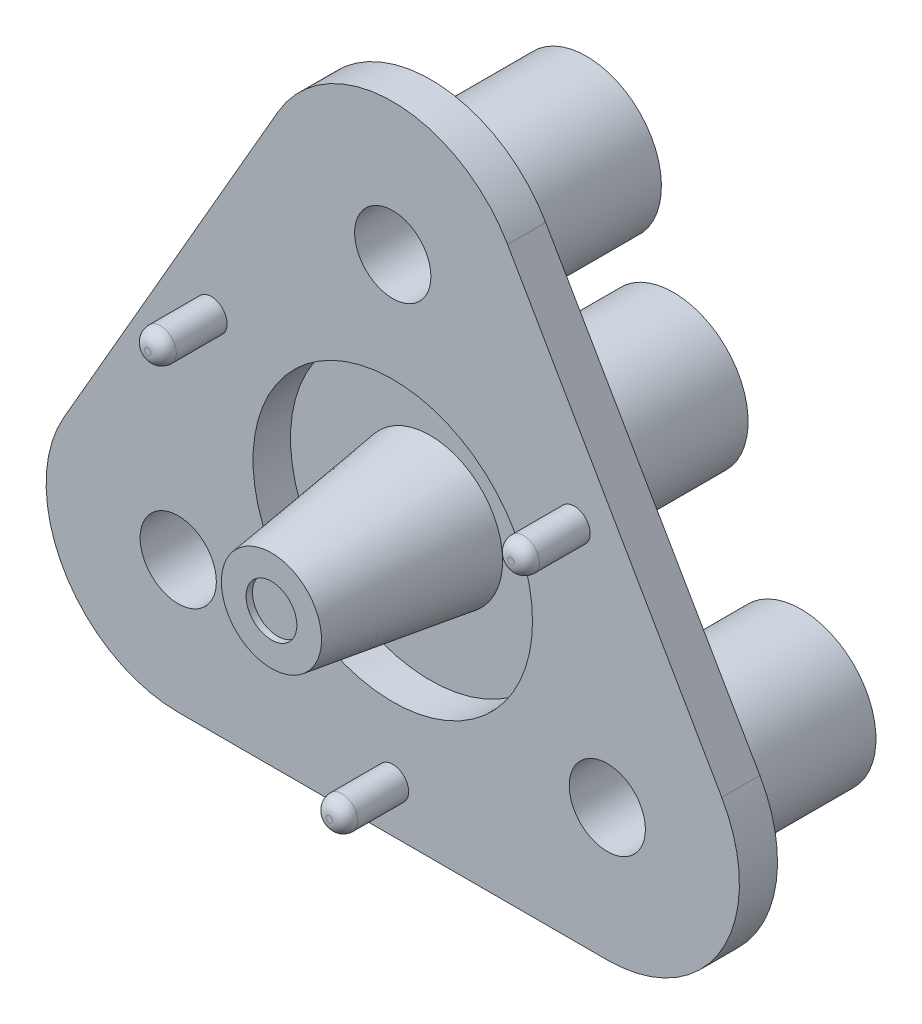
from build123d import *

# Parameters (mm, degrees)
BOSS_EXTRUDE1_DEPTH      = 1.524
SKETCH2_R                = 5.588
CUT_EXTRUDE1_DEPTH       = 1.4986
SKETCH3_R                = 2.8956
BOSS_EXTRUDE2_DEPTH      = 6.35
CHAMFER1_SIZE            = 6.35
CHAMFER1_SIZE_2          = 0.8924343
SKETCH4_R                = 1.016
CUT_EXTRUDE2_DEPTH       = 0.254
SKETCH5_R                = 7.366
BOSS_EXTRUDE3_DEPTH      = 1.778
BOSS_EXTRUDE4_DEPTH      = 1.778
CIRPATTERN1_COUNT        = 3
SKETCH7_R                = 2.9972
BOSS_EXTRUDE5_DEPTH      = 4.445
CIRPATTERN2_COUNT        = 3
SKETCH8_R                = 1.4859
CUT_EXTRUDE3_DEPTH       = 0.0508
CIRPATTERN3_COUNT        = 3
SKETCH9_R                = 2.9845
BOSS_EXTRUDE6_DEPTH      = 7.9248
CUT_EXTRUDE4_DEPTH       = 14.732
SKETCH11_R               = 1.524
CUT_EXTRUDE5_DEPTH       = 3.81
SKETCH16_R               = 1.524
CUT_EXTRUDE6_DEPTH       = 6.35
CIRPATTERN4_COUNT        = 3
SKETCH17_R               = 0.635
BOSS_EXTRUDE7_DEPTH      = 2.54
FILLET1_R                = 0.508
CIRPATTERN6_COUNT        = 3
FILLET1_OF_CIRPATTERN6_R = 0.508


with BuildPart() as part:
    # Sketch1 → Boss-Extrude1 (new body)
    with BuildSketch(Plane.XY):
        with BuildLine():
            Line((-4.591507335, 12.551273129), (-13.156663816, -2.315614668))
            ThreePointArc((-13.156663816, -2.315614668), (-13.153016231, -7.596706494), (-8.57884765, -10.2362))
            Line((-8.57884765, -10.2362), (8.57884765, -10.2362))
            ThreePointArc((8.57884765, -10.2362), (13.153016231, -7.596706494), (13.156663816, -2.315614668))
            Line((13.156663816, -2.315614668), (4.591507335, 12.551273129))
            ThreePointArc((4.591507335, 12.551273129), (0, 15.205000805), (-4.591507335, 12.551273129))
        make_face()
    extrude(amount=BOSS_EXTRUDE1_DEPTH)

    # Sketch2 → Cut-Extrude1 (cut)
    with BuildSketch(Plane.XY.offset(1.524)):
        Circle(SKETCH2_R)
    extrude(amount=-CUT_EXTRUDE1_DEPTH, mode=Mode.SUBTRACT)

    # Sketch3 → Boss-Extrude2 (add)
    with BuildSketch(Plane.XY.offset(0.0254)):
        Circle(SKETCH3_R)
    extrude(amount=BOSS_EXTRUDE2_DEPTH)

    # Chamfer1
    # the kernel refuses this chamfer: 6.35, 0.8924343 mm, written as the material it takes off along each edge
    with BuildSketch(Plane(origin=(0, 0, 6.3754), x_dir=(1, 0, 0), z_dir=(0, -1, 0))) as chamfer1_piece_1:
        Polygon((2.8956, -CHAMFER1_SIZE), (2.8956 - CHAMFER1_SIZE_2, 0), (2.8956, 0), align=None)
    revolve(axis=Axis((0, 0, 6.3754), (0, 0, 1)), mode=Mode.SUBTRACT)

    # Sketch4 → Cut-Extrude2 (cut)
    with BuildSketch(Plane.XY.offset(6.3754)):
        Circle(SKETCH4_R)
    extrude(amount=-CUT_EXTRUDE2_DEPTH, mode=Mode.SUBTRACT)

    # Sketch5 → Boss-Extrude3 (add)
    with BuildSketch(Plane(origin=(0, 0, 0), x_dir=(-1, 0, 0), z_dir=(0, 0, -1))):
        Circle(SKETCH5_R)
    extrude(amount=BOSS_EXTRUDE3_DEPTH)

    # Sketch6 → Boss-Extrude4 (add)
    with BuildSketch(Plane(origin=(0, 0, 0), x_dir=(-1, 0, 0), z_dir=(0, 0, -1))):
        with BuildLine():
            ThreePointArc((-1.366070827, 7.238218462), (0, 12.9032), (1.366070827, 7.238218462))
            ThreePointArc((1.366070827, 7.238218462), (0, 7.366), (-1.366070827, 7.238218462))
        make_face()
    boss_extrude4 = extrude(amount=BOSS_EXTRUDE4_DEPTH)

    # CirPattern1: Boss-Extrude4 ×3 about axis
    cirpattern1_axis = Axis((0, 0, 0), (0, 0, 1))
    for i in range(1, CIRPATTERN1_COUNT):
        add(boss_extrude4.rotate(cirpattern1_axis, i * 360 / CIRPATTERN1_COUNT))

    # Sketch7 → Boss-Extrude5 (add)
    with BuildSketch(Plane(origin=(0, 0, -1.778), x_dir=(-1, 0, 0), z_dir=(0, 0, -1))):
        with Locations(Location((0, 9.906, 0), (0, 0, 242.884717398))):
            Circle(SKETCH7_R)
    boss_extrude5 = extrude(amount=BOSS_EXTRUDE5_DEPTH)

    # CirPattern2: Boss-Extrude5 ×3 about axis
    cirpattern2_axis = Axis((0, 0, 0), (0, 0, 1))
    for i in range(1, CIRPATTERN2_COUNT):
        add(boss_extrude5.rotate(cirpattern2_axis, i * 360 / CIRPATTERN2_COUNT))

    # Sketch8 → Cut-Extrude3 (cut)
    with BuildSketch(Plane(origin=(0, 0, -6.223), x_dir=(-1, 0, 0), z_dir=(0, 0, -1))):
        with Locations((8.57884765, -4.953)):
            Circle(SKETCH8_R)
    cut_extrude3 = extrude(amount=-CUT_EXTRUDE3_DEPTH, mode=Mode.SUBTRACT)

    # CirPattern3: Cut-Extrude3 ×3 about axis
    cirpattern3_axis = Axis((0, 0, 0), (0, 0, 1))
    for i in range(1, CIRPATTERN3_COUNT):
        add(cut_extrude3.rotate(cirpattern3_axis, i * 360 / CIRPATTERN3_COUNT), mode=Mode.SUBTRACT)

    # Sketch9 → Boss-Extrude6 (add)
    with BuildSketch(Plane(origin=(0, 0, -1.778), x_dir=(-1, 0, 0), z_dir=(0, 0, -1))):
        Circle(SKETCH9_R)
    extrude(amount=BOSS_EXTRUDE6_DEPTH)

    # Sketch10 → Cut-Extrude4 (cut)
    with BuildSketch(Plane(origin=(0, 0, -9.7028), x_dir=(-1, 0, 0), z_dir=(0, 0, -1))):
        Polygon((-1.466469684, 0), (-0.733234842, -1.27), (0.733234842, -1.27), (1.466469684, 0), (0.733234842, 1.27), (-0.733234842, 1.27), align=None)
    extrude(amount=-CUT_EXTRUDE4_DEPTH, mode=Mode.SUBTRACT)

    # Sketch11 → Cut-Extrude5 (cut)
    with BuildSketch(Plane(origin=(0, 0, -9.7028), x_dir=(-1, 0, 0), z_dir=(0, 0, -1))):
        Circle(SKETCH11_R)
    extrude(amount=-CUT_EXTRUDE5_DEPTH, mode=Mode.SUBTRACT)

    # Sketch16 → Cut-Extrude6 (cut)
    with BuildSketch(Plane.XY.offset(1.524)):
        with Locations((-8.57884765, -4.953)):
            Circle(SKETCH16_R)
    cut_extrude6 = extrude(amount=-CUT_EXTRUDE6_DEPTH, mode=Mode.SUBTRACT)

    # CirPattern4: Cut-Extrude6 ×3 about axis
    cirpattern4_axis = Axis((0, 0, 0), (0, 0, 1))
    for i in range(1, CIRPATTERN4_COUNT):
        add(cut_extrude6.rotate(cirpattern4_axis, i * 360 / CIRPATTERN4_COUNT), mode=Mode.SUBTRACT)

    # Sketch17 → Boss-Extrude7 (add)
    with BuildSketch(Plane.XY.offset(1.524)):
        with Locations(Location((0, -8.382, 0), (0, 0, 180))):
            Circle(SKETCH17_R)
    boss_extrude7 = extrude(amount=BOSS_EXTRUDE7_DEPTH)

    # Fillet1
    fillet1_edges = [part.edges().sort_by_distance(p)[0] for p in [
        (0.635, -8.382, 4.064),
    ]]
    fillet(fillet1_edges, radius=FILLET1_R)

    # CirPattern6: Boss-Extrude7 ×3 about axis
    cirpattern6_axis = Axis((0, 0, 0), (0, 0, 1))
    for i in range(1, CIRPATTERN6_COUNT):
        add(boss_extrude7.rotate(cirpattern6_axis, i * 360 / CIRPATTERN6_COUNT))

    # Fillet1 of CirPattern6
    fillet1_of_cirpattern6_edges = [part.edges().sort_by_distance(p)[0] for p in [
        (6.941524935, 4.740926131, 4.064),
        (-7.576524935, 3.641073869, 4.064),
    ]]
    fillet(fillet1_of_cirpattern6_edges, radius=FILLET1_OF_CIRPATTERN6_R)


solid = part.part
